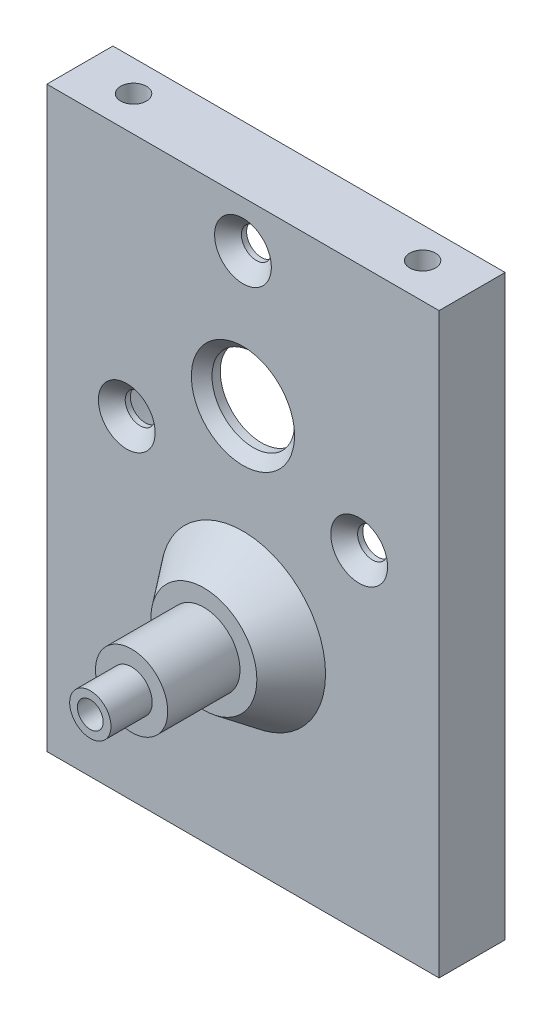
from build123d import *

# Parameters (mm, degrees)
ESBO_O1_W                     = 38
ESBO_O1_H                     = 56
ESBO_O1_R                     = 4
RESSALTO_EXTRUS_O1_DEPTH      = 6.4
ESBO_O6_R                     = 16.54
CORTE_EXTRUS_O5_DEPTH         = 4.6
ESBO_O7_R                     = 4
ESBO_O7_R_2                   = 1.25
CORTE_EXTRUS_O6_DEPTH         = 60.314079273
RESSALTO_EXTRUS_O2_DEPTH      = 4.6
RESSALTO_EXTRUS_O3_DEPTH      = 5.59
ESBO_O17_R                    = 3.5
RESSALTO_EXTRUS_O4_DEPTH      = 7
ESBO_O18_R                    = 2
RESSALTO_EXTRUS_O5_DEPTH      = 4
CHANFRO1_SIZE                 = 4
CHANFRO1_SIZE_2               = 5.29
FURO_ROSCADO_DE_M3X0_51_D     = 2.5
FURO_ROSCADO_DE_M3X0_51_DEPTH = 10
FURO_ROSCADO_DE_M3X0_51_TIP   = 0.751075774
CHANFRO2_SIZE                 = 1
SKETCH1_R                     = 1.25
CUT_EXTRUDE1_DEPTH            = 6
SKETCH2_R                     = 1.25
CUT_EXTRUDE2_DEPTH            = 10


# Read off the part's stored shape, not the designer's step: Escareado para parafuso de máquina com cabeça chata de M2.51
with BuildPart() as part:
    # Esboço1 → Ressalto-extrusão1 (new body)
    with BuildSketch(Plane.XY):
        with Locations((0, 28)):
            Rectangle(ESBO_O1_W, ESBO_O1_H)
        with Locations((0, 20)):
            Circle(ESBO_O1_R, mode=Mode.SUBTRACT)
    extrude(amount=RESSALTO_EXTRUS_O1_DEPTH)

    # Esboço6 → Corte-extrusão5 (cut)
    with BuildSketch(Plane(origin=(0, 0, 0), x_dir=(-1, 0, 0), z_dir=(0, 0, -1))):
        with Locations((0, 38.5)):
            Circle(ESBO_O6_R)
    extrude(amount=-CORTE_EXTRUS_O5_DEPTH, mode=Mode.SUBTRACT)

    # Esboço7 → Corte-extrusão6 (cut, through all)
    with BuildSketch(Plane(origin=(0, 0, 4.6), x_dir=(-1, 0, 0), z_dir=(0, 0, -1))):
        with Locations((0, 38.5)):
            Circle(ESBO_O7_R)
        with Locations((11.258330249, 32)):
            Circle(ESBO_O7_R_2)
        with Locations((-11.258330249, 32)):
            Circle(ESBO_O7_R_2)
        with Locations((0, 51.5)):
            Circle(ESBO_O7_R_2)
    extrude(amount=-CORTE_EXTRUS_O6_DEPTH, mode=Mode.SUBTRACT)

    # Escareado para parafuso de m_quina c 2 → Escareado para parafuso de máquina com cabeça chata de M2.51 (revolve, cut)
    with BuildSketch(Plane(origin=(-11.258330249, 32, 0), x_dir=(1, 0, 0), z_dir=(0, -1, 0))):
        Polygon((1.25, 4.6), (1.45, 4.6), (1.45, 5.1), (2.75, 6.4), (1.25, 6.4), align=None)
    revolve(axis=Axis((-11.258330249, 32, 0), (0, 0, 1)), mode=Mode.SUBTRACT)

    # Escareado para parafuso de m_quina c 3 o → Escareado para parafuso de m_quina c 3 (revolve, cut)
    with BuildSketch(Plane(origin=(11.258330249, 32, 0), x_dir=(1, 0, 0), z_dir=(0, -1, 0))):
        Polygon((1.25, 4.6), (1.45, 4.6), (1.45, 5.1), (2.75, 6.4), (1.25, 6.4), align=None)
    revolve(axis=Axis((11.258330249, 32, 0), (0, 0, 1)), mode=Mode.SUBTRACT)

    # Escareado para parafuso de m_quina c 4 o → Escareado para parafuso de m_quina c 4 (revolve, cut)
    with BuildSketch(Plane.XZ.offset(-51.5)):
        Polygon((1.25, 4.6), (1.45, 4.6), (1.45, 5.1), (2.75, 6.4), (1.25, 6.4), align=None)
    revolve(axis=Axis((0, 51.5, 0), (0, 0, 1)), mode=Mode.SUBTRACT)

    # Esboço15 → Ressalto-extrusão2 (add)
    with BuildSketch(Plane(origin=(0, 0, 0), x_dir=(-1, 0, 0), z_dir=(0, 0, -1))):
        with BuildLine():
            ThreePointArc((-3.280592218, 22.288605405), (0, 16), (3.280592218, 22.288605405))
            ThreePointArc((3.280592218, 22.288605405), (0, 21.96), (-3.280592218, 22.288605405))
        make_face()
    extrude(amount=-RESSALTO_EXTRUS_O2_DEPTH)

    # Esboço16 → Ressalto-extrusão3 (add)
    with BuildSketch(Plane.XY.offset(4.6)):
        with BuildLine():
            ThreePointArc((-3.280592218, 22.288605405), (0, 16), (3.280592218, 22.288605405))
            ThreePointArc((3.280592218, 22.288605405), (0, 24), (-3.280592218, 22.288605405))
        make_face()
    extrude(amount=RESSALTO_EXTRUS_O3_DEPTH)

    # Esboço17 → Ressalto-extrusão4 (add)
    with BuildSketch(Plane.XY.offset(10.19)):
        with Locations((0, 20)):
            Circle(ESBO_O17_R)
    extrude(amount=RESSALTO_EXTRUS_O4_DEPTH)

    # Esboço18 → Ressalto-extrusão5 (add)
    with BuildSketch(Plane.XY.offset(17.19)):
        with Locations((0, 20)):
            Circle(ESBO_O18_R)
    extrude(amount=RESSALTO_EXTRUS_O5_DEPTH)

    # Chanfro1
    # the kernel refuses this chamfer: 5.29, 4 mm, written as the material it adds along each edge
    with BuildSketch(Plane(origin=(0, 20, 6.4), x_dir=(0.8201480544065356, 0.5721513513513485, 0), z_dir=(-0.5721513513513485, 0.8201480544065356, 0))) as chanfro1_piece_1_section:
        Polygon((4 + CHANFRO1_SIZE, 0), (4, -CHANFRO1_SIZE_2), (4, 0), align=None)
    chanfro1_piece_1 = revolve(axis=Axis((0, 20, 6.4), (0, 0, -1)), mode=Mode.PRIVATE)
    chanfro1_piece_1 = split(chanfro1_piece_1, bisect_by=Plane(origin=(-5.391672128, 16.238663888, 10.19), z_dir=(0, 0, -1)), keep=Keep.TOP, mode=Mode.PRIVATE)
    add(chanfro1_piece_1)

    # Furo roscado de M3x0.51
    with Locations(Plane.XY.offset(21.19)):
        with Locations((0, 20)):
            Hole(FURO_ROSCADO_DE_M3X0_51_D / 2, depth=FURO_ROSCADO_DE_M3X0_51_DEPTH)
            with Locations((0, 0, -(FURO_ROSCADO_DE_M3X0_51_DEPTH + FURO_ROSCADO_DE_M3X0_51_TIP / 2))):  # 118° drill point
                Cone(0, FURO_ROSCADO_DE_M3X0_51_D / 2, FURO_ROSCADO_DE_M3X0_51_TIP, mode=Mode.SUBTRACT)

    # Chanfro2
    chanfro2_edges = [part.edges().sort_by_distance(p)[0] for p in [
        (4, 38.5, 6.4),
    ]]
    chamfer(chanfro2_edges, length=CHANFRO2_SIZE)

    # Sketch1 → Cut-Extrude1 (cut)
    with BuildSketch(Plane(origin=(0, 56, 0), x_dir=(1, 0, 0), z_dir=(0, 1, 0))):
        with Locations(Location((-14, -3, 0), (0, 0, 180))):
            Circle(SKETCH1_R)
        with Locations((14, -3)):
            Circle(SKETCH1_R)
    extrude(amount=-CUT_EXTRUDE1_DEPTH, mode=Mode.SUBTRACT)

    # Sketch2 → Cut-Extrude2 (cut)
    with BuildSketch(Plane(origin=(0, 0, 0), x_dir=(-1, 0, 0), z_dir=(0, -1, 0))):
        with Locations(Location((-12, -3, 0), (0, 0, 90))):
            Circle(SKETCH2_R)
        with Locations(Location((0, -3, 0), (0, 0, 90))):
            Circle(SKETCH2_R)
        with Locations(Location((12, -3, 0), (0, 0, 270))):
            Circle(SKETCH2_R)
    extrude(amount=-CUT_EXTRUDE2_DEPTH, mode=Mode.SUBTRACT)


solid = part.part
